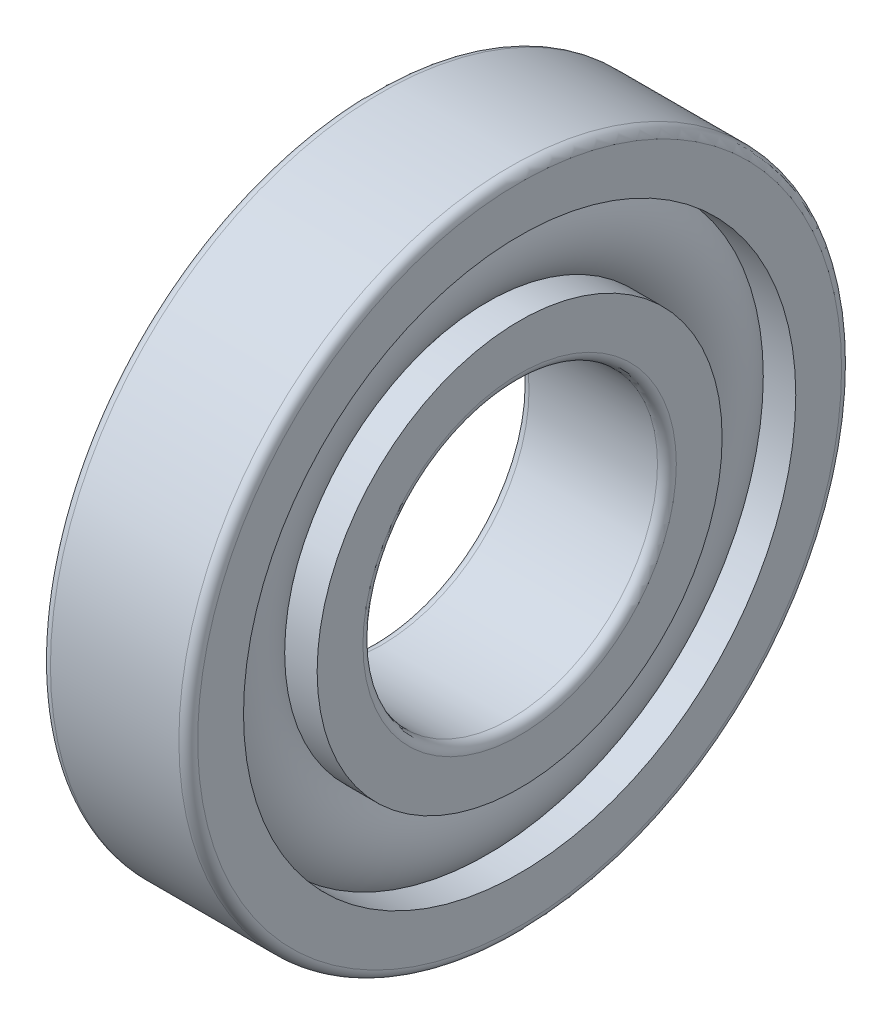
from build123d import *

# Parameters (mm, degrees)
CAGSPISKE_W     = 0.47625
CAGSPISKE_H     = 0.79375
CAGESPINE_ANGLE = 0.001
BALSIMSKE_R     = 2.38125


with BuildPart() as part:
    # CagSpiSke → CageSpine (revolve)
    with BuildSketch(Plane.XY):
        with Locations((0, 10.31875)):
            Rectangle(CAGSPISKE_W, CAGSPISKE_H)
    revolve(axis=Axis((-20.6375, 0, 0), (-1, 0, 0)), revolution_arc=CAGESPINE_ANGLE)

    # BalSimSke → BallsSimplified (revolve)
    with BuildSketch(Plane.XY):
        with Locations((0, 10.31875)):
            Circle(BALSIMSKE_R)
    revolve(axis=Axis((-10, 0, 0), (1, 0, 0)))

    # InnRacSke → InnerRace (revolve)
    with BuildSketch(Plane.XY):
        with BuildLine():
            Line((-1.71525303, 8.73125), (-3.175, 8.73125))
            Line((-3.175, 8.73125), (-3.175, 6.7564))
            ThreePointArc((-3.175, 6.7564), (-3.055968196, 6.469031804), (-2.7686, 6.35))
            Line((-2.7686, 6.35), (2.7686, 6.35))
            ThreePointArc((2.7686, 6.35), (3.055968196, 6.469031804), (3.175, 6.7564))
            Line((3.175, 6.7564), (3.175, 8.73125))
            Line((3.175, 8.73125), (1.76605303, 8.73125))
            ThreePointArc((1.76605303, 8.73125), (0.0254, 7.9629), (-1.71525303, 8.73125))
        make_face()
    revolve(axis=Axis((-20.6375, 0, 0), (1, 0, 0)))

    # OutRacSke → OuterRace (revolve)
    with BuildSketch(Plane.XY):
        with BuildLine():
            Line((-1.74065303, 11.90625), (-3.175, 11.90625))
            Line((-3.175, 11.90625), (-3.175, 13.8811))
            ThreePointArc((-3.175, 13.8811), (-3.055968196, 14.168468196), (-2.7686, 14.2875))
            Line((-2.7686, 14.2875), (2.7686, 14.2875))
            ThreePointArc((2.7686, 14.2875), (3.055968196, 14.168468196), (3.175, 13.8811))
            Line((3.175, 13.8811), (3.175, 11.90625))
            Line((3.175, 11.90625), (1.74065303, 11.90625))
            ThreePointArc((1.74065303, 11.90625), (0, 12.6746), (-1.74065303, 11.90625))
        make_face()
    revolve(axis=Axis((-20.6375, 0, 0), (1, 0, 0)))


solid = part.part
